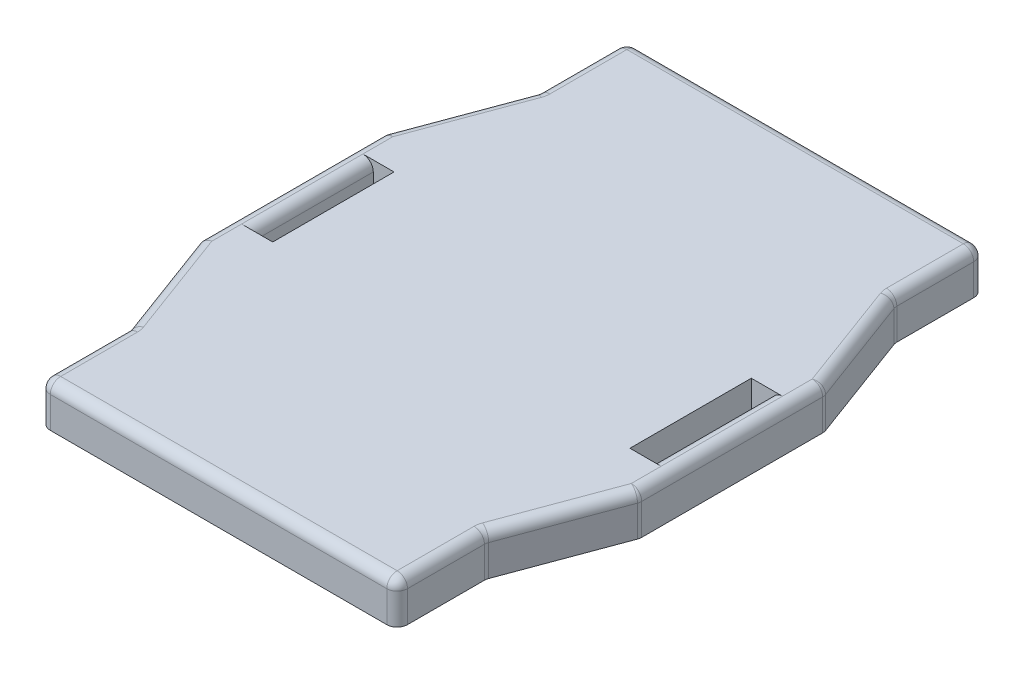
from build123d import *

# Parameters (mm, degrees)
SKETCH1_W           = 86
SKETCH1_H           = 141.3
BOSS_EXTRUDE1_DEPTH = 4
SKETCH1_3_W         = 86
SKETCH1_3_H         = 141.3
SKETCH1_3_W_2       = 74
SKETCH1_3_H_2       = 129.3
BOSS_EXTRUDE2_DEPTH = 6
BOSS_EXTRUDE3_DEPTH = 10
FILLET2_R           = 2.5


with BuildPart() as part:
    # Sketch1 → Boss-Extrude1 (new body)
    with BuildSketch(Plane(origin=(0, 0, 0), x_dir=(1, 0, 0), z_dir=(0, 1, 0))):
        Rectangle(SKETCH1_W, SKETCH1_H)
    extrude(amount=BOSS_EXTRUDE1_DEPTH)

    # Sketch1<3> → Boss-Extrude2 (add)
    with BuildSketch(Plane(origin=(0, 0, 0), x_dir=(1, 0, 0), z_dir=(0, 1, 0))):
        Rectangle(SKETCH1_3_W, SKETCH1_3_H)
        Rectangle(SKETCH1_3_W_2, SKETCH1_3_H_2, mode=Mode.SUBTRACT)
    extrude(amount=-BOSS_EXTRUDE2_DEPTH)

    # Sketch2 → Boss-Extrude3 (add)
    with BuildSketch(Plane(origin=(0, 4, 0), x_dir=(1, 0, 0), z_dir=(0, 1, 0))):
        Polygon((-43, 49.188592066), (-53, 22.225), (-53, -22.225), (-43, -49.188592066), (-43, -22.225), (-43, -14.605), (-48, -14.605), (-48, 14.605), (-43, 14.605), (-43, 22.225), align=None)
        Polygon((53, 22.225), (43, 22.225), (43, 14.605), (48, 14.605), (48, -14.605), (43, -14.605), (43, -22.225), (43, -49.188592066), (53, -22.225), align=None)
        Polygon((43, 49.188592066), (43, 22.225), (53, 22.225), align=None)
    extrude(amount=-BOSS_EXTRUDE3_DEPTH)

    # Fillet2
    fillet2_edges = [part.edges().sort_by_distance(p)[0] for p in [
        (0, 4, 70.65),
        (43, 4, -59.919296033),
        (-43, 4, 59.919296033),
        (0, 4, -70.65),
        (-48, 4, -35.706796033),
        (-53, -1, -22.225),
        (-43, -1, -49.188592066),
        (-43, -1, 49.188592066),
        (-53, 4, 0),
        (-48, 4, 35.706796033),
        (-48, 4, 0),
        (43, 4, 59.919296033),
        (43, -1, -49.188592066),
        (53, 4, 0),
        (53, -1, -22.225),
        (48, 4, 35.706796033),
        (53, -1, 22.225),
        (43, -1, 49.188592066),
        (48, 4, 0),
        (-43, 4, -59.919296033),
        (48, 4, -35.706796033),
        (43, -1, -70.65),
        (43, -1, 70.65),
        (-43, -1, 70.65),
        (-43, -1, -70.65),
    ]]
    fillet(fillet2_edges, radius=FILLET2_R - 0.0001)  # a hair under: the kernel refuses the full size


solid = part.part
